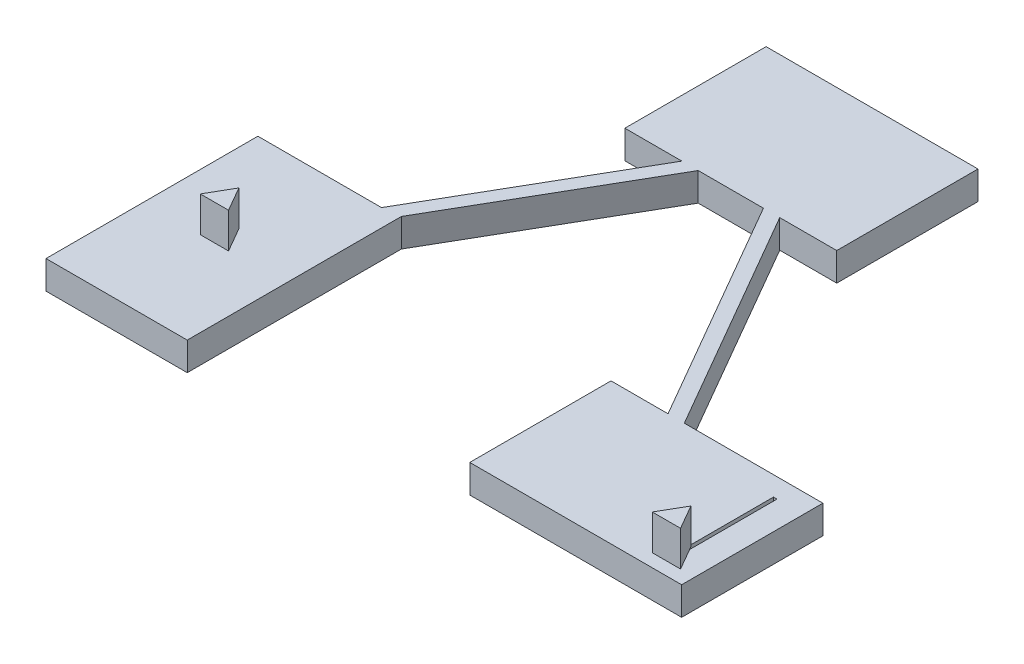
from build123d import *

# Parameters (mm, degrees)
BOSS_EXTRUDE1_DEPTH       = 10
BOSS_EXTRUDE4_DEPTH       = 5
BOSS_EXTRUDE5_START       = 5
BOSS_EXTRUDE5_DEPTH       = 5
BOSS_EXTRUDE6_START       = 5
BOSS_EXTRUDE6_DEPTH       = 50
SKETCH5_W                 = 2.5
SKETCH5_H                 = 10
SKETCH5_H_2               = 2.5
BOSS_EXTRUDE7_DEPTH       = 10
BOSS_EXTRUDE22_DEPTH      = 22.5
BOSS_EXTRUDE22_DEPTH_BACK = 5
BOSS_EXTRUDE8_DEPTH       = 10
BOSS_EXTRUDE9_DEPTH       = 10
BOSS_EXTRUDE10_START      = 10
BOSS_EXTRUDE10_DEPTH      = 10
SKETCH9_R                 = 2.5
BOSS_EXTRUDE11_DEPTH      = 10
BOSS_EXTRUDE12_DEPTH      = 10
BOSS_EXTRUDE13_START      = -10
SKETCH9_4_W               = 5
SKETCH9_4_H               = 5
BOSS_EXTRUDE13_DEPTH      = 2.5
BOSS_EXTRUDE14_DEPTH      = 10
SKETCH9_5_R               = 2.5
BOSS_EXTRUDE17_DEPTH      = 20
BOSS_EXTRUDE18_DEPTH      = 10
BOSS_EXTRUDE19_START      = 10
SKETCH10_4_R              = 2.5
BOSS_EXTRUDE19_DEPTH      = 5
BOSS_EXTRUDE20_START      = 15
BOSS_EXTRUDE20_DEPTH      = 50
BOSS_EXTRUDE21_DEPTH      = 5
BOSS_EXTRUDE21_DEPTH_BACK = 35
SHELL1_START              = -30
SHELL1_DEPTH              = 30
SKETCH10_6_R              = 2.5
CUT_EXTRUDE1_DEPTH        = 810.38839421
CUT_EXTRUDE2_DEPTH        = 5
CUT_EXTRUDE3_DEPTH        = 2.5
FILLET1_R                 = 1
CUT_EXTRUDE4_DEPTH        = 2.5


# Read off the part's stored shape, not the designer's step: Shell1
with BuildPart() as part:
    # Sketch3 → Boss-Extrude1 (new body)
    with BuildSketch(Plane(origin=(0, 0, 0), x_dir=(1, 0, 0), z_dir=(0, 1, 0))):
        with BuildLine():
            Line((407.5, -587.115242271), (410, -587.115242271))
            Line((410, -587.115242271), (412.5, -587.115242271))
            Line((412.5, -587.115242271), (412.5, -589.615242271))
            Line((412.5, -589.615242271), (412.5, -592.115242271))
            Line((412.5, -592.115242271), (410, -592.115242271))
            Line((410, -592.115242271), (407.5, -592.115242271))
            Line((407.5, -592.115242271), (395.223290994, -592.115242271))
            Line((395.223290994, -592.115242271), (393.779915321, -594.615242271))
            Line((393.779915321, -594.615242271), (410, -594.615242271))
            ThreePointArc((410, -594.615242271), (415, -589.615242271), (410, -584.615242271))
            Line((410, -584.615242271), (399.553418013, -584.615242271))
            Line((399.553418013, -584.615242271), (398.11004234, -587.115242271))
            Line((398.11004234, -587.115242271), (407.5, -587.115242271))
        make_face()
        with BuildLine():
            Line((412.5, -587.115242271), (410, -587.115242271))
            ThreePointArc((410, -587.115242271), (411.767766953, -587.847475318), (412.5, -589.615242271))
            Line((412.5, -589.615242271), (412.5, -587.115242271))
        make_face()
        with BuildLine():
            Line((412.5, -592.115242271), (412.5, -589.615242271))
            ThreePointArc((412.5, -589.615242271), (411.767766953, -591.383009224), (410, -592.115242271))
            Line((410, -592.115242271), (412.5, -592.115242271))
        make_face()
        with BuildLine():
            Line((335, -587.115242271), (398.11004234, -587.115242271))
            Line((398.11004234, -587.115242271), (399.553418013, -584.615242271))
            Line((399.553418013, -584.615242271), (335, -584.615242271))
            ThreePointArc((335, -584.615242271), (330, -589.615242271), (335, -594.615242271))
            Line((335, -594.615242271), (393.779915321, -594.615242271))
            Line((393.779915321, -594.615242271), (395.223290994, -592.115242271))
            Line((395.223290994, -592.115242271), (335, -592.115242271))
            ThreePointArc((335, -592.115242271), (332.5, -589.615242271), (335, -587.115242271))
        make_face()
    extrude(amount=-BOSS_EXTRUDE1_DEPTH)

    # Sketch3<5> → Boss-Extrude4 (add)
    with BuildSketch(Plane(origin=(0, 0, 0), x_dir=(1, 0, 0), z_dir=(0, 1, 0))):
        with BuildLine():
            ThreePointArc((412.5, -589.615242271), (411.767766953, -587.847475318), (410, -587.115242271))
            Line((410, -587.115242271), (407.5, -587.115242271))
            Line((407.5, -587.115242271), (407.5, -592.115242271))
            Line((407.5, -592.115242271), (410, -592.115242271))
            ThreePointArc((410, -592.115242271), (411.767766953, -591.383009224), (412.5, -589.615242271))
        make_face()
    extrude(amount=-BOSS_EXTRUDE4_DEPTH)

    # Sketch3<6> → Boss-Extrude5 (add)
    with BuildSketch(Plane(origin=(0, 0, 0), x_dir=(1, 0, 0), z_dir=(0, 1, 0)).offset(BOSS_EXTRUDE5_START)):
        with BuildLine():
            Line((412.5, -587.115242271), (410, -587.115242271))
            ThreePointArc((410, -587.115242271), (411.767766953, -587.847475318), (412.5, -589.615242271))
            Line((412.5, -589.615242271), (412.5, -587.115242271))
        make_face()
        with BuildLine():
            ThreePointArc((412.5, -589.615242271), (411.767766953, -587.847475318), (410, -587.115242271))
            Line((410, -587.115242271), (407.5, -587.115242271))
            Line((407.5, -587.115242271), (407.5, -592.115242271))
            Line((407.5, -592.115242271), (410, -592.115242271))
            ThreePointArc((410, -592.115242271), (411.767766953, -591.383009224), (412.5, -589.615242271))
        make_face()
        with BuildLine():
            Line((412.5, -592.115242271), (412.5, -589.615242271))
            ThreePointArc((412.5, -589.615242271), (411.767766953, -591.383009224), (410, -592.115242271))
            Line((410, -592.115242271), (412.5, -592.115242271))
        make_face()
    extrude(amount=-BOSS_EXTRUDE5_DEPTH)

    # Sketch3<7> → Boss-Extrude6 (add)
    with BuildSketch(Plane(origin=(0, 0, 0), x_dir=(1, 0, 0), z_dir=(0, 1, 0)).offset(BOSS_EXTRUDE6_START)):
        Polygon((410, -566.521231503), (390, -601.162247654), (430, -601.162247654), align=None)
    extrude(amount=BOSS_EXTRUDE6_DEPTH)

    # Fillet1
    fillet1_edges = [part.edges().sort_by_distance(p)[0] for p in [
        (412.5, 2.5, 587.115242271),
        (407.5, 2.5, 587.115242271),
        (407.5, 2.5, 592.115242271),
        (412.5, 2.5, 592.115242271),
    ]]
    fillet(fillet1_edges, radius=FILLET1_R)


with BuildPart() as body_2:
    # Sketch5 → Boss-Extrude7 (new body)
    # profile 1 of 9: a face of its own
    with BuildSketch(Plane.XZ.offset(10)):
        with BuildLine():
            Line((330, 557.91651246), (330, 567.91651246))
            Line((330, 567.91651246), (245, 567.91651246))
            Line((245, 567.91651246), (245, 433.012701892))
            ThreePointArc((245, 433.012701892), (250, 428.012701892), (255, 433.012701892))
            Line((255, 433.012701892), (255, 557.91651246))
            Line((255, 557.91651246), (330, 557.91651246))
        make_face()
        with BuildLine():
            Line((247.5, 433.012701892), (247.5, 562.91651246))
            ThreePointArc((247.5, 562.91651246), (250, 565.41651246), (252.5, 562.91651246))
            Line((252.5, 562.91651246), (252.5, 433.012701892))
            ThreePointArc((252.5, 433.012701892), (250, 430.512701892), (247.5, 433.012701892))
        make_face(mode=Mode.SUBTRACT)
    # profile 2 of 9: a face of its own
    with BuildSketch(Plane.XZ.offset(10)):
        with Locations((331.25, 562.91651246)):
            Rectangle(SKETCH5_W, SKETCH5_H)
    # profile 3 of 9: a face of its own
    with BuildSketch(Plane.XZ.offset(10)):
        with BuildLine():
            Line((332.5, 557.91651246), (330, 557.91651246))
            Line((330, 557.91651246), (330, 449.615242271))
            ThreePointArc((330, 449.615242271), (335, 444.615242271), (340, 449.615242271))
            Line((340, 449.615242271), (340, 562.91651246))
            ThreePointArc((340, 562.91651246), (339.330127019, 560.41651246), (337.5, 558.586385441))
            Line((337.5, 558.586385441), (337.5, 449.615242271))
            ThreePointArc((337.5, 449.615242271), (335, 447.115242271), (332.5, 449.615242271))
            Line((332.5, 449.615242271), (332.5, 557.91651246))
        make_face()
    # profile 4 of 9: a face of its own
    with BuildSketch(Plane.XZ.offset(10)):
        with BuildLine():
            ThreePointArc((340, 562.91651246), (339.330127019, 565.41651246), (337.5, 567.246639479))
            Line((337.5, 567.246639479), (337.5, 558.586385441))
            ThreePointArc((337.5, 558.586385441), (339.330127019, 560.41651246), (340, 562.91651246))
        make_face()
    # profile 5 of 9: a face of its own
    with BuildSketch(Plane.XZ.offset(10)):
        with BuildLine():
            Line((340, 584.615242271), (337.5, 584.615242271))
            Line((337.5, 584.615242271), (337.5, 567.246639479))
            ThreePointArc((337.5, 567.246639479), (339.330127019, 565.41651246), (340, 562.91651246))
            Line((340, 562.91651246), (340, 584.615242271))
        make_face()
    # profile 6 of 9: a face of its own
    with BuildSketch(Plane.XZ.offset(10)):
        with Locations((338.75, 585.865242271)):
            Rectangle(SKETCH5_W, SKETCH5_H_2)
    # profile 7 of 9: a face of its own
    with BuildSketch(Plane.XZ.offset(10)):
        with BuildLine():
            ThreePointArc((340, 589.615242271), (339.829629131, 590.909337496), (339.330127019, 592.115242271))
            Line((339.330127019, 592.115242271), (335, 592.115242271))
            ThreePointArc((335, 592.115242271), (336.767766953, 591.383009224), (337.5, 589.615242271))
            Line((337.5, 589.615242271), (337.5, 587.115242271))
            Line((337.5, 587.115242271), (340, 587.115242271))
            Line((340, 587.115242271), (340, 589.615242271))
        make_face()
    # profile 8 of 9: a face of its own
    with BuildSketch(Plane.XZ.offset(10)):
        with BuildLine():
            ThreePointArc((335, 594.615242271), (331.464466094, 593.150776177), (330, 589.615242271))
            ThreePointArc((330, 589.615242271), (330.669872981, 587.115242271), (332.5, 585.285115252))
            Line((332.5, 585.285115252), (332.5, 589.615242271))
            ThreePointArc((332.5, 589.615242271), (333.232233047, 591.383009224), (335, 592.115242271))
            Line((335, 592.115242271), (339.330127019, 592.115242271))
            ThreePointArc((339.330127019, 592.115242271), (337.5, 593.94536929), (335, 594.615242271))
        make_face()
    # profile 9 of 9: a face of its own
    with BuildSketch(Plane.XZ.offset(10)):
        with BuildLine():
            ThreePointArc((332.5, 585.285115252), (330.669872981, 587.115242271), (330, 589.615242271))
            Line((330, 589.615242271), (330, 567.91651246))
            Line((330, 567.91651246), (332.5, 567.91651246))
            Line((332.5, 567.91651246), (332.5, 585.285115252))
        make_face()
    extrude(amount=BOSS_EXTRUDE7_DEPTH)


with BuildPart() as body_3:
    # Sketch5<4> → Boss-Extrude22 (new, two sides: drawn at the far end of the back side and taken through both)
    with BuildSketch(Plane.XZ.offset(10).offset(-BOSS_EXTRUDE22_DEPTH_BACK)):
        with BuildLine():
            ThreePointArc((335, 592.115242271), (333.232233047, 591.383009224), (332.5, 589.615242271))
            ThreePointArc((332.5, 589.615242271), (333.232233047, 587.847475318), (335, 587.115242271))
            ThreePointArc((335, 587.115242271), (336.767766953, 587.847475318), (337.5, 589.615242271))
            ThreePointArc((337.5, 589.615242271), (336.767766953, 591.383009224), (335, 592.115242271))
        make_face()
    extrude(amount=BOSS_EXTRUDE22_DEPTH + BOSS_EXTRUDE22_DEPTH_BACK)


with BuildPart() as body_4:
    # Sketch7 → Boss-Extrude8 (new body)
    with BuildSketch(Plane(origin=(0, -10, 0), x_dir=(1, 0, 0), z_dir=(0, 1, 0))):
        with BuildLine():
            Line((37.5, -69.951905284), (34.613248654, -69.951905284))
            Line((34.613248654, -69.951905284), (245, -434.352447854))
            Line((245, -434.352447854), (245, -433.012701892))
            ThreePointArc((245, -433.012701892), (248.705904774, -428.183072761), (254.330127019, -430.512701892))
            Line((254.330127019, -430.512701892), (46.160254038, -69.951905284))
            Line((46.160254038, -69.951905284), (37.5, -69.951905284))
        make_face()
        with BuildLine():
            Line((245, -433.012701892), (245, -434.352447854))
            Line((245, -434.352447854), (245.669872981, -435.512701892))
            ThreePointArc((245.669872981, -435.512701892), (246.464466094, -436.548235798), (247.5, -437.342828911))
            Line((247.5, -437.342828911), (247.5, -433.012701892))
            ThreePointArc((247.5, -433.012701892), (250, -430.512701892), (252.5, -433.012701892))
            Line((252.5, -433.012701892), (252.5, -437.342828911))
            ThreePointArc((252.5, -437.342828911), (254.330127019, -435.512701892), (255, -433.012701892))
            ThreePointArc((255, -433.012701892), (254.829629131, -431.718606667), (254.330127019, -430.512701892))
            ThreePointArc((254.330127019, -430.512701892), (248.705904774, -428.183072761), (245, -433.012701892))
        make_face()
        with BuildLine():
            ThreePointArc((252.5, -433.012701892), (250, -430.512701892), (247.5, -433.012701892))
            ThreePointArc((247.5, -433.012701892), (250, -435.512701892), (252.5, -433.012701892))
        make_face()
        with BuildLine():
            Line((247.5, -433.012701892), (247.5, -437.342828911))
            ThreePointArc((247.5, -437.342828911), (250, -438.012701892), (252.5, -437.342828911))
            Line((252.5, -437.342828911), (252.5, -433.012701892))
            ThreePointArc((252.5, -433.012701892), (250, -435.512701892), (247.5, -433.012701892))
        make_face()
        with BuildLine():
            ThreePointArc((41.830127019, -67.451905284), (40, -69.282032303), (37.5, -69.951905284))
            Line((37.5, -69.951905284), (46.160254038, -69.951905284))
            Line((46.160254038, -69.951905284), (44.716878365, -67.451905284))
            Line((44.716878365, -67.451905284), (41.830127019, -67.451905284))
        make_face()
        with BuildLine():
            ThreePointArc((33.169872981, -67.451905284), (35, -69.282032303), (37.5, -69.951905284))
            ThreePointArc((37.5, -69.951905284), (40, -69.282032303), (41.830127019, -67.451905284))
            Line((41.830127019, -67.451905284), (37.5, -67.451905284))
            Line((37.5, -67.451905284), (33.169872981, -67.451905284))
        make_face()
        with BuildLine():
            ThreePointArc((-37.5, -59.951905284), (-42.5, -64.951905284), (-37.5, -69.951905284))
            Line((-37.5, -69.951905284), (34.613248654, -69.951905284))
            Line((34.613248654, -69.951905284), (33.169872981, -67.451905284))
            Line((33.169872981, -67.451905284), (-37.5, -67.451905284))
            ThreePointArc((-37.5, -67.451905284), (-40, -64.951905284), (-37.5, -62.451905284))
            Line((-37.5, -62.451905284), (33.169872981, -62.451905284))
            ThreePointArc((33.169872981, -62.451905284), (35, -60.621778265), (37.5, -59.951905284))
            Line((37.5, -59.951905284), (-37.5, -59.951905284))
        make_face()
        with BuildLine():
            Line((33.169872981, -67.451905284), (34.613248654, -69.951905284))
            Line((34.613248654, -69.951905284), (37.5, -69.951905284))
            ThreePointArc((37.5, -69.951905284), (35, -69.282032303), (33.169872981, -67.451905284))
        make_face()
        with BuildLine():
            ThreePointArc((41.830127019, -62.451905284), (40, -60.621778265), (37.5, -59.951905284))
            ThreePointArc((37.5, -59.951905284), (35, -60.621778265), (33.169872981, -62.451905284))
            Line((33.169872981, -62.451905284), (37.5, -62.451905284))
            Line((37.5, -62.451905284), (41.830127019, -62.451905284))
        make_face()
        with BuildLine():
            Line((112.5, -59.951905284), (37.5, -59.951905284))
            ThreePointArc((37.5, -59.951905284), (40, -60.621778265), (41.830127019, -62.451905284))
            Line((41.830127019, -62.451905284), (112.5, -62.451905284))
            ThreePointArc((112.5, -62.451905284), (115, -64.951905284), (112.5, -67.451905284))
            Line((112.5, -67.451905284), (44.716878365, -67.451905284))
            Line((44.716878365, -67.451905284), (46.160254038, -69.951905284))
            Line((46.160254038, -69.951905284), (112.5, -69.951905284))
            ThreePointArc((112.5, -69.951905284), (117.5, -64.951905284), (112.5, -59.951905284))
        make_face()
    extrude(amount=BOSS_EXTRUDE8_DEPTH)

    # Sketch7<3> → Boss-Extrude9 (add)
    with BuildSketch(Plane(origin=(0, -10, 0), x_dir=(1, 0, 0), z_dir=(0, 1, 0))):
        with BuildLine():
            ThreePointArc((247.5, -433.012701892), (250, -435.512701892), (252.5, -433.012701892))
            ThreePointArc((252.5, -433.012701892), (250, -430.512701892), (247.5, -433.012701892))
        make_face()
    extrude(amount=-BOSS_EXTRUDE9_DEPTH)


with BuildPart() as body_5:
    # Sketch8 → Boss-Extrude10 (new body)
    # profile 1 of 4: a face of its own
    with BuildSketch(Plane.XZ.offset(10).offset(BOSS_EXTRUDE10_START)):
        with BuildLine():
            Line((-34.613248654, 69.951905284), (-356.339745962, 627.198544763))
            Line((-356.339745962, 627.198544763), (-290, 627.198544763))
            ThreePointArc((-290, 627.198544763), (-285, 632.198544763), (-290, 637.198544763))
            Line((-290, 637.198544763), (-373.660254038, 637.198544763))
            Line((-373.660254038, 637.198544763), (-41.830127019, 62.451905284))
            ThreePointArc((-41.830127019, 62.451905284), (-41.830127019, 67.451905284), (-37.5, 69.951905284))
            Line((-37.5, 69.951905284), (-34.613248654, 69.951905284))
        make_face()
        with BuildLine():
            Line((-290, 629.698544763), (-365, 629.698544763))
            ThreePointArc((-365, 629.698544763), (-367.5, 632.198544763), (-365, 634.698544763))
            Line((-365, 634.698544763), (-290, 634.698544763))
            ThreePointArc((-290, 634.698544763), (-287.5, 632.198544763), (-290, 629.698544763))
        make_face(mode=Mode.SUBTRACT)
    # profile 2 of 4: a face of its own
    with BuildSketch(Plane.XZ.offset(10).offset(BOSS_EXTRUDE10_START)):
        with BuildLine():
            Line((-33.169872981, 67.451905284), (-34.613248654, 69.951905284))
            Line((-34.613248654, 69.951905284), (-37.5, 69.951905284))
            ThreePointArc((-37.5, 69.951905284), (-41.830127019, 67.451905284), (-41.830127019, 62.451905284))
            ThreePointArc((-41.830127019, 62.451905284), (-40, 60.621778265), (-37.5, 59.951905284))
            ThreePointArc((-37.5, 59.951905284), (-35, 60.621778265), (-33.169872981, 62.451905284))
            Line((-33.169872981, 62.451905284), (-37.5, 62.451905284))
            ThreePointArc((-37.5, 62.451905284), (-40, 64.951905284), (-37.5, 67.451905284))
            Line((-37.5, 67.451905284), (-33.169872981, 67.451905284))
        make_face()
    # profile 3 of 4: a face of its own
    with BuildSketch(Plane.XZ.offset(10).offset(BOSS_EXTRUDE10_START)):
        with BuildLine():
            ThreePointArc((-33.169872981, 62.451905284), (-32.5, 64.951905284), (-33.169872981, 67.451905284))
            Line((-33.169872981, 67.451905284), (-37.5, 67.451905284))
            ThreePointArc((-37.5, 67.451905284), (-35.732233047, 66.719672237), (-35, 64.951905284))
            ThreePointArc((-35, 64.951905284), (-35.732233047, 63.184138331), (-37.5, 62.451905284))
            Line((-37.5, 62.451905284), (-33.169872981, 62.451905284))
        make_face()
    # profile 4 of 4: a face of its own
    with BuildSketch(Plane.XZ.offset(10).offset(BOSS_EXTRUDE10_START)):
        with BuildLine():
            ThreePointArc((-35, 64.951905284), (-35.732233047, 66.719672237), (-37.5, 67.451905284))
            ThreePointArc((-37.5, 67.451905284), (-40, 64.951905284), (-37.5, 62.451905284))
            ThreePointArc((-37.5, 62.451905284), (-35.732233047, 63.184138331), (-35, 64.951905284))
        make_face()
    extrude(amount=BOSS_EXTRUDE10_DEPTH)

    # Sketch8<3> → Boss-Extrude14 (add, symmetric)
    with BuildSketch(Plane.XZ.offset(10)):
        with BuildLine():
            ThreePointArc((-37.5, 62.451905284), (-35.732233047, 63.184138331), (-35, 64.951905284))
            ThreePointArc((-35, 64.951905284), (-35.732233047, 66.719672237), (-37.5, 67.451905284))
            ThreePointArc((-37.5, 67.451905284), (-40, 64.951905284), (-37.5, 62.451905284))
        make_face()
    extrude(amount=BOSS_EXTRUDE14_DEPTH, both=True)


with BuildPart() as body_6:
    # Sketch9 → Boss-Extrude11 (new body)
    # profile 1 of 9: a face of its own
    with BuildSketch(Plane(origin=(0, -20, 0), x_dir=(1, 0, 0), z_dir=(0, 1, 0))):
        with BuildLine():
            ThreePointArc((-290, -627.198544763), (-286.464466094, -628.663010857), (-285, -632.198544763))
            Line((-285, -632.198544763), (-285, -600.172180289))
            Line((-285, -600.172180289), (-273.710284952, -600.172180289))
            ThreePointArc((-273.710284952, -600.172180289), (-268.710284952, -595.172180289), (-273.710284952, -590.172180289))
            Line((-273.710284952, -590.172180289), (-295, -590.172180289))
            Line((-295, -590.172180289), (-295, -627.198544763))
            Line((-295, -627.198544763), (-290, -627.198544763))
        make_face()
        with Locations((-273.710284952, -595.172180289)):
            Circle(SKETCH9_R, mode=Mode.SUBTRACT)
    # profile 2 of 9: a face of its own
    with BuildSketch(Plane(origin=(0, -20, 0), x_dir=(1, 0, 0), z_dir=(0, 1, 0))):
        with BuildLine():
            ThreePointArc((-295, -632.198544763), (-294.829629131, -633.492639988), (-294.330127019, -634.698544763))
            Line((-294.330127019, -634.698544763), (-292.5, -634.698544763))
            Line((-292.5, -634.698544763), (-292.5, -632.198544763))
            Line((-292.5, -632.198544763), (-292.5, -629.698544763))
            Line((-292.5, -629.698544763), (-295, -629.698544763))
            Line((-295, -629.698544763), (-295, -632.198544763))
        make_face()
    # profile 3 of 9: a face of its own
    with BuildSketch(Plane(origin=(0, -20, 0), x_dir=(1, 0, 0), z_dir=(0, 1, 0))):
        with BuildLine():
            Line((-292.5, -629.698544763), (-292.5, -632.198544763))
            ThreePointArc((-292.5, -632.198544763), (-291.767766953, -630.43077781), (-290, -629.698544763))
            Line((-290, -629.698544763), (-292.5, -629.698544763))
        make_face()
    # profile 4 of 9: a face of its own
    with BuildSketch(Plane(origin=(0, -20, 0), x_dir=(1, 0, 0), z_dir=(0, 1, 0))):
        with BuildLine():
            ThreePointArc((-290, -629.698544763), (-288.232233047, -630.43077781), (-287.5, -632.198544763))
            Line((-287.5, -632.198544763), (-287.5, -629.698544763))
            Line((-287.5, -629.698544763), (-290, -629.698544763))
        make_face()
    # profile 5 of 9: a face of its own
    with BuildSketch(Plane(origin=(0, -20, 0), x_dir=(1, 0, 0), z_dir=(0, 1, 0))):
        with BuildLine():
            ThreePointArc((-287.5, -632.198544763), (-288.232233047, -633.966311716), (-290, -634.698544763))
            Line((-290, -634.698544763), (-287.5, -634.698544763))
            Line((-287.5, -634.698544763), (-287.5, -632.198544763))
        make_face()
    # profile 6 of 9: a face of its own
    with BuildSketch(Plane(origin=(0, -20, 0), x_dir=(1, 0, 0), z_dir=(0, 1, 0))):
        with BuildLine():
            Line((-292.5, -632.198544763), (-292.5, -634.698544763))
            Line((-292.5, -634.698544763), (-290, -634.698544763))
            ThreePointArc((-290, -634.698544763), (-291.767766953, -633.966311716), (-292.5, -632.198544763))
        make_face()
    # profile 7 of 9: a face of its own
    with BuildSketch(Plane(origin=(0, -20, 0), x_dir=(1, 0, 0), z_dir=(0, 1, 0))):
        with BuildLine():
            ThreePointArc((-292.5, -632.198544763), (-291.767766953, -633.966311716), (-290, -634.698544763))
            ThreePointArc((-290, -634.698544763), (-288.232233047, -633.966311716), (-287.5, -632.198544763))
            ThreePointArc((-287.5, -632.198544763), (-288.232233047, -630.43077781), (-290, -629.698544763))
            ThreePointArc((-290, -629.698544763), (-291.767766953, -630.43077781), (-292.5, -632.198544763))
        make_face()
    # profile 8 of 9: a face of its own
    with BuildSketch(Plane(origin=(0, -20, 0), x_dir=(1, 0, 0), z_dir=(0, 1, 0))):
        with BuildLine():
            ThreePointArc((-290, -637.198544763), (-286.464466094, -635.734078669), (-285, -632.198544763))
            ThreePointArc((-285, -632.198544763), (-286.464466094, -628.663010857), (-290, -627.198544763))
            Line((-290, -627.198544763), (-295, -627.198544763))
            Line((-295, -627.198544763), (-295, -629.698544763))
            Line((-295, -629.698544763), (-292.5, -629.698544763))
            Line((-292.5, -629.698544763), (-290, -629.698544763))
            Line((-290, -629.698544763), (-287.5, -629.698544763))
            Line((-287.5, -629.698544763), (-287.5, -632.198544763))
            Line((-287.5, -632.198544763), (-287.5, -634.698544763))
            Line((-287.5, -634.698544763), (-290, -634.698544763))
            Line((-290, -634.698544763), (-292.5, -634.698544763))
            Line((-292.5, -634.698544763), (-294.330127019, -634.698544763))
            ThreePointArc((-294.330127019, -634.698544763), (-292.5, -636.528671782), (-290, -637.198544763))
        make_face()
    # profile 9 of 9: a face of its own
    with BuildSketch(Plane(origin=(0, -20, 0), x_dir=(1, 0, 0), z_dir=(0, 1, 0))):
        with Locations((-273.710284952, -595.172180289)):
            Circle(SKETCH9_R)
    extrude(amount=BOSS_EXTRUDE11_DEPTH)

    # Sketch9<3> → Boss-Extrude12 (add)
    with BuildSketch(Plane(origin=(0, -20, 0), x_dir=(1, 0, 0), z_dir=(0, 1, 0))):
        with BuildLine():
            ThreePointArc((-292.5, -632.198544763), (-291.767766953, -633.966311716), (-290, -634.698544763))
            ThreePointArc((-290, -634.698544763), (-288.232233047, -633.966311716), (-287.5, -632.198544763))
            ThreePointArc((-287.5, -632.198544763), (-288.232233047, -630.43077781), (-290, -629.698544763))
            ThreePointArc((-290, -629.698544763), (-291.767766953, -630.43077781), (-292.5, -632.198544763))
        make_face()
    extrude(amount=-BOSS_EXTRUDE12_DEPTH)

    # Sketch9<4> → Boss-Extrude13 (add)
    with BuildSketch(Plane(origin=(0, -20, 0), x_dir=(1, 0, 0), z_dir=(0, 1, 0)).offset(BOSS_EXTRUDE13_START)):
        with Locations((-290, -632.198544763)):
            Rectangle(SKETCH9_4_W, SKETCH9_4_H)
    extrude(amount=-BOSS_EXTRUDE13_DEPTH)

    # Sketch9<5> → Boss-Extrude17 (add)
    with BuildSketch(Plane(origin=(0, -20, 0), x_dir=(1, 0, 0), z_dir=(0, 1, 0))):
        with Locations(Location((-273.710284952, -595.172180289, 0), (0, 0, 270))):
            Circle(SKETCH9_5_R)
    extrude(amount=BOSS_EXTRUDE17_DEPTH)


with BuildPart() as body_7:
    # Sketch10 → Boss-Extrude18 (new body)
    with BuildSketch(Plane(origin=(0, -10, 0), x_dir=(1, 0, 0), z_dir=(0, 1, 0))):
        with BuildLine():
            ThreePointArc((-295.277691374, -517.97213508), (-301.64310719, -514.892933645), (-304.722308626, -521.258349461))
            Line((-304.722308626, -521.258349461), (-278.432593579, -596.81528748))
            ThreePointArc((-278.432593579, -596.81528748), (-272.067177762, -599.894488915), (-268.987976326, -593.529073099))
            Line((-268.987976326, -593.529073099), (-295.277691374, -517.97213508))
        make_face()
        with BuildLine():
            ThreePointArc((-293.721790347, -545.266425496), (-292.182189629, -542.083717587), (-288.999481721, -543.623318305))
            Line((-288.999481721, -543.623318305), (-271.349130639, -594.350626694))
            ThreePointArc((-271.349130639, -594.350626694), (-272.888731357, -597.533334602), (-276.071439266, -595.993733884))
            Line((-276.071439266, -595.993733884), (-293.721790347, -545.266425496))
        make_face(mode=Mode.SUBTRACT)
    extrude(amount=BOSS_EXTRUDE18_DEPTH)

    # Sketch10<4> → Boss-Extrude19 (add)
    with BuildSketch(Plane(origin=(0, -10, 0), x_dir=(1, 0, 0), z_dir=(0, 1, 0)).offset(BOSS_EXTRUDE19_START)):
        with Locations(Location((-300, -519.615242271, 0), (0, 0, 270))):
            Circle(SKETCH10_4_R)
    extrude(amount=BOSS_EXTRUDE19_DEPTH)

    # Sketch10<5> → Boss-Extrude20 (add)
    with BuildSketch(Plane(origin=(0, -10, 0), x_dir=(1, 0, 0), z_dir=(0, 1, 0)).offset(BOSS_EXTRUDE20_START)):
        Polygon((-280, -531.162247654), (-300, -496.521231503), (-320, -531.162247654), align=None)
    extrude(amount=BOSS_EXTRUDE20_DEPTH)


with BuildPart() as body_8:
    # Sketch1 → Boss-Extrude21 (new, two sides: drawn at the far end of the back side and taken through both)
    with BuildSketch(Plane(origin=(0, 0, 0), x_dir=(1, 0, 0), z_dir=(0, 1, 0)).offset(-BOSS_EXTRUDE21_DEPTH_BACK)):
        Polygon((-400, -369.615242271), (-400, -669.615242271), (-200, -669.615242271), (-200, -366.410161514), (-46.188021535, -100), (46.188021535, -100), (230.717967697, -419.615242271), (150, -419.615242271), (150, -619.615242271), (450, -619.615242271), (450, -419.615242271), (253.811978465, -419.615242271), (69.282032303, -100), (150, -100), (150, 100), (-150, 100), (-150, -100), (-69.282032303, -100), (-224.944465005, -369.615242271), align=None)
    extrude(amount=BOSS_EXTRUDE21_DEPTH + BOSS_EXTRUDE21_DEPTH_BACK)

    # Shell1 outline → Shell1 (cut)
    with BuildSketch(Plane(origin=(0, 0, 0), x_dir=(1, 0, 0), z_dir=(0, 1, 0)).offset(SHELL1_START)):
        Polygon((239.378221735, -424.615242271), (155, -424.615242271), (155, -614.615242271), (445, -614.615242271), (445, -424.615242271), (250.925227119, -424.615242271), (60.621778265, -95), (145, -95), (145, 95), (-145, 95), (-145, -95), (-60.621778265, -95), (-222.057713659, -374.615242271), (-395, -374.615242271), (-395, -664.615242271), (-205, -664.615242271), (-205, -365.070415552), (-49.074772881, -95), (49.074772881, -95), align=None)
    extrude(amount=SHELL1_DEPTH, mode=Mode.SUBTRACT)

    # Sketch10<6> → Cut-Extrude1 (cut, through all)
    with BuildSketch(Plane(origin=(0, -10, 0), x_dir=(1, 0, 0), z_dir=(0, 1, 0))):
        with Locations(Location((-300, -519.615242271, 0), (0, 0, 270))):
            Circle(SKETCH10_6_R)
    extrude(amount=CUT_EXTRUDE1_DEPTH, mode=Mode.SUBTRACT)

    # Sketch11 → Cut-Extrude2 (cut)
    with BuildSketch(Plane(origin=(0, 5, 0), x_dir=(1, 0, 0), z_dir=(0, 1, 0))):
        Polygon((407.5, -449.615242271), (407.5, -589.615242271), (407.5, -592.115242271), (412.5, -592.115242271), (412.5, -589.615242271), (412.5, -449.615242271), (412.5, -447.115242271), (407.5, -447.115242271), align=None)
    extrude(amount=-CUT_EXTRUDE2_DEPTH, mode=Mode.SUBTRACT)

    # Sketch12 → Cut-Extrude3 (cut)
    with BuildSketch(Plane(origin=(0, -30, 0), x_dir=(1, 0, 0), z_dir=(0, 1, 0))):
        Polygon((-287.5, -632.198544763), (-287.5, -502.294734195), (-287.5, -499.794734195), (-292.5, -499.794734195), (-292.5, -502.294734195), (-292.5, -632.198544763), (-292.5, -634.698544763), (-287.5, -634.698544763), align=None)
    extrude(amount=-CUT_EXTRUDE3_DEPTH, mode=Mode.SUBTRACT)

    # Sketch13 → Cut-Extrude4 (cut)
    with BuildSketch(Plane(origin=(0, -30, 0), x_dir=(1, 0, 0), z_dir=(0, 1, 0))):
        with BuildLine():
            Line((337.203699925, -590.795795802), (412.203699925, -450.795795802))
            ThreePointArc((412.203699925, -450.795795802), (411.180553531, -447.411542346), (407.796300075, -448.434688739))
            Line((407.796300075, -448.434688739), (332.796300075, -588.434688739))
            ThreePointArc((332.796300075, -588.434688739), (333.819446469, -591.818942196), (337.203699925, -590.795795802))
        make_face()
    extrude(amount=-CUT_EXTRUDE4_DEPTH, mode=Mode.SUBTRACT)


solid = Compound([part.part, body_2.part, body_3.part, body_4.part, body_5.part, body_6.part, body_7.part, body_8.part])
